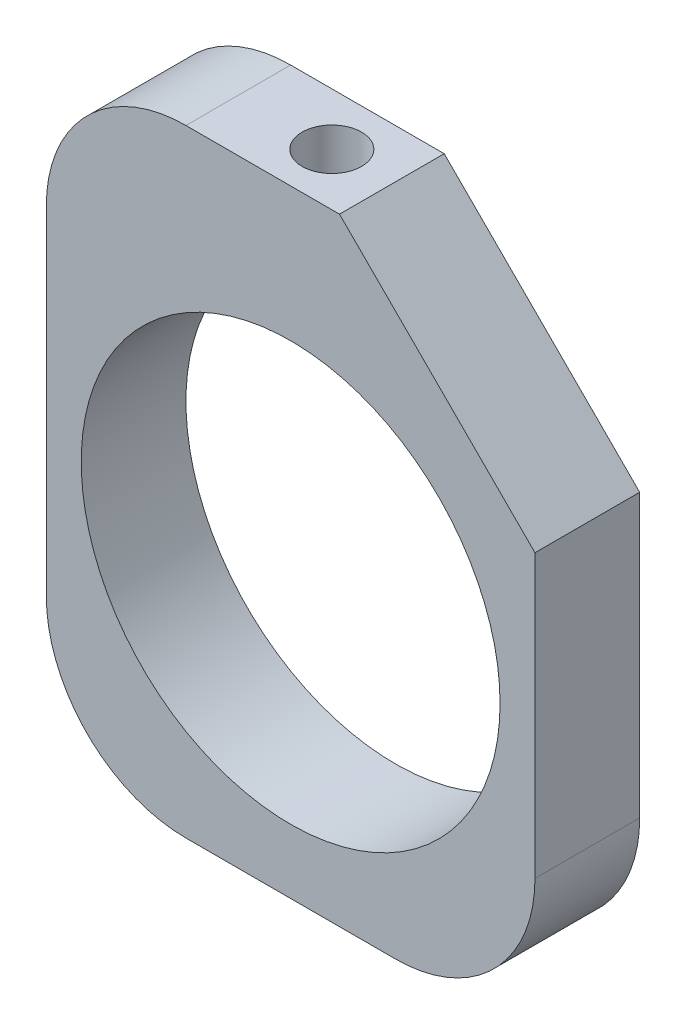
from build123d import *

# Parameters (mm, degrees)
SKETCH1_R                     = 9.525
BOSS_EXTRUDE2_DEPTH           = 4.7625
TAP_DRILL_FOR_6_32_TAP1_D     = 2.7051
TAP_DRILL_FOR_6_32_TAP1_DEPTH = 19.05
TAP_DRILL_FOR_6_32_TAP1_TIP   = 0.81269403
CHAMFER1_SIZE                 = 8.89


with BuildPart() as part:
    # Sketch1 → Boss-Extrude2 (new body)
    with BuildSketch(Plane.XY):
        with BuildLine():
            ThreePointArc((-4.7625, 15.621), (-9.252628061, 13.761128061), (-11.1125, 9.271))
            Line((-11.1125, 9.271), (-11.1125, -6.096))
            ThreePointArc((-11.1125, -6.096), (-9.252628061, -10.586128061), (-4.7625, -12.446))
            Line((-4.7625, -12.446), (4.7625, -12.446))
            ThreePointArc((4.7625, -12.446), (9.252628061, -10.586128061), (11.1125, -6.096))
            Line((11.1125, -6.096), (11.1125, 15.621))
            Line((11.1125, 15.621), (-4.7625, 15.621))
        make_face()
        Circle(SKETCH1_R, mode=Mode.SUBTRACT)
    extrude(amount=BOSS_EXTRUDE2_DEPTH)

    # Tap Drill for #6-32 Tap1
    with Locations(Plane(origin=(0, 15.621, 0), x_dir=(1, 0, 0), z_dir=(0, 1, 0))):
        with Locations((-0.508, -2.38125)):
            Hole(TAP_DRILL_FOR_6_32_TAP1_D / 2, depth=TAP_DRILL_FOR_6_32_TAP1_DEPTH)
            with Locations((0, 0, -(TAP_DRILL_FOR_6_32_TAP1_DEPTH + TAP_DRILL_FOR_6_32_TAP1_TIP / 2))):  # 118° drill point
                Cone(0, TAP_DRILL_FOR_6_32_TAP1_D / 2, TAP_DRILL_FOR_6_32_TAP1_TIP, mode=Mode.SUBTRACT)

    # Chamfer1
    chamfer1_edges = [part.edges().sort_by_distance(p)[0] for p in [
        (11.1125, 15.621, 2.38125),
    ]]
    chamfer(chamfer1_edges, length=CHAMFER1_SIZE)


solid = part.part
